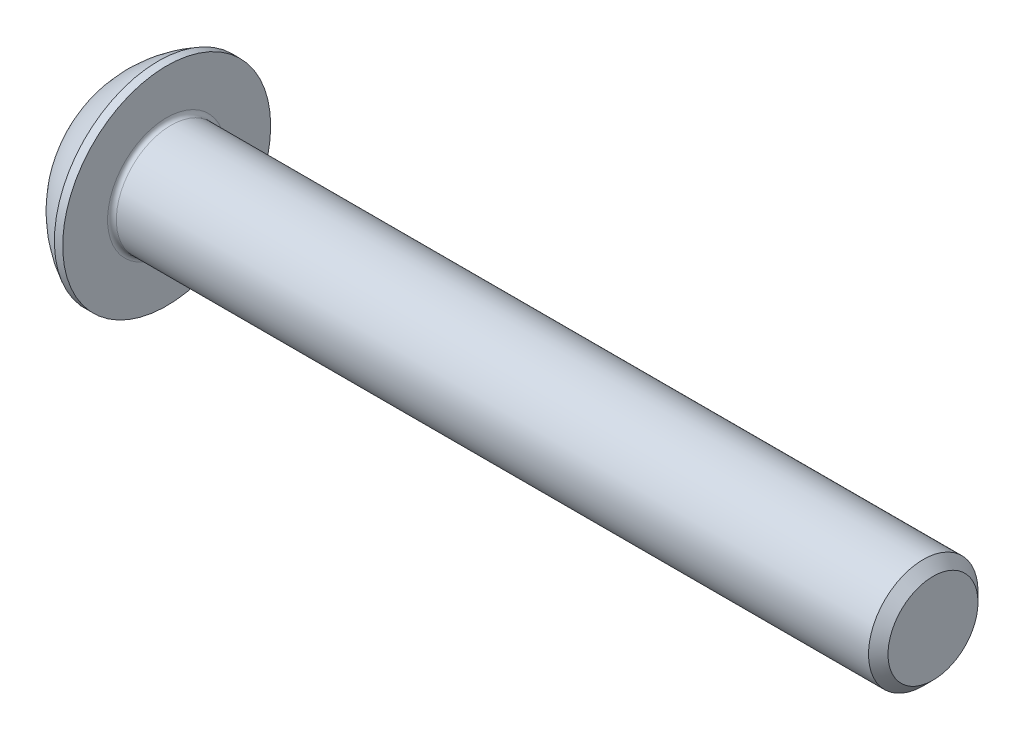
from build123d import *

# Parameters (mm, degrees)
FILLET_1_R  = 0.2
HEX_2_DEPTH = 1.56


with BuildPart() as part:
    # Эскиз1 → Body (revolve)
    with BuildSketch(Plane.XY):
        with BuildLine():
            Line((0, 2.375), (0, 0))
            Line((0, 0), (37.75, 0))
            Line((37.75, 0), (37.75, 2.055))
            Line((37.75, 2.055), (37.305, 2.5))
            Line((37.305, 2.5), (2.75, 2.5))
            Line((2.75, 2.5), (2.75, 4.75))
            Line((2.75, 4.75), (2.370164642, 4.75))
            ThreePointArc((2.370164642, 4.75), (0.992749859, 3.754440885), (0, 2.375))
        make_face()
    revolve(axis=Axis((-3.643489966, 0, 0), (-1, 0, 0)))

    # Скругление1
    fillet_1_edges = [part.edges().sort_by_distance(p)[0] for p in [
        (2.75, -2.5, 0),
    ]]
    fillet(fillet_1_edges, radius=FILLET_1_R)

    # Эскиз2 → Вырез-Повернуть1 (revolve, cut)
    with BuildSketch(Plane.XY):
        Polygon((0, 0), (0, 1.5), (1.56, 1.5), (2.426025404, 0), align=None)
    revolve(axis=Axis((2.426025404, 0, 0), (-1, 0, 0)), mode=Mode.SUBTRACT)

    # Эскиз3 → Hex 2 (cut)
    with BuildSketch(Plane.ZY):
        Polygon((-1.5, -0.866025404), (0, -1.732050808), (1.5, -0.866025404), (1.5, 0.866025404), (0, 1.732050808), (-1.5, 0.866025404), align=None)
    extrude(amount=-HEX_2_DEPTH, mode=Mode.SUBTRACT)


solid = part.part
